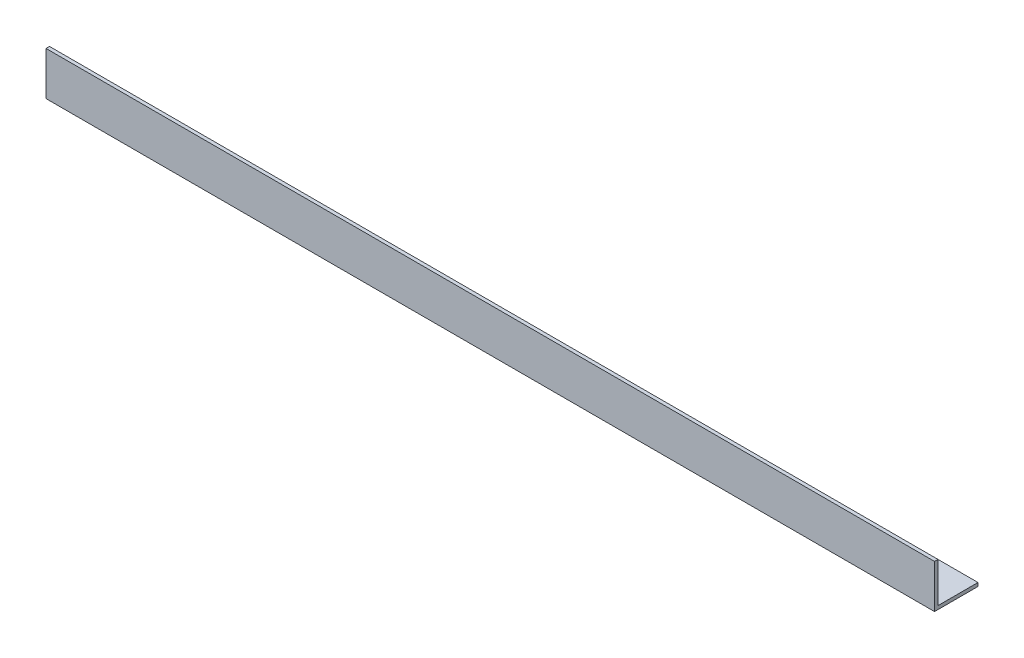
from build123d import *

# Parameters (mm, degrees)
EXTRUDE_1_DEPTH = 511


with BuildPart() as part:
    # Эскиз1 → Вытянуть-Тонкостенный1 (new body)
    with BuildSketch(Plane(origin=(0, 0, 0), x_dir=(0, 0, -1), z_dir=(1, 0, 0))):
        Polygon((0, 25), (0, 0), (25, 0), (25, 2), (2, 2), (2, 25), align=None)
    extrude(amount=EXTRUDE_1_DEPTH)


solid = part.part
